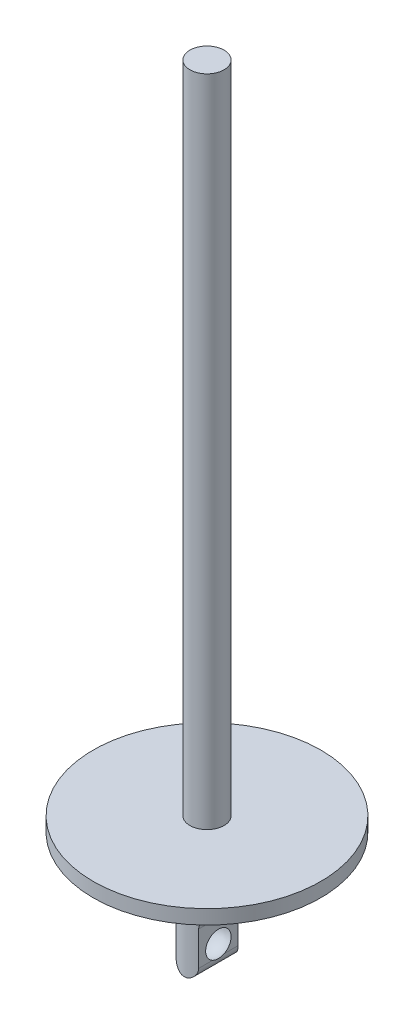
from build123d import *

# Parameters (mm, degrees)
SCHIZZO1_R                   = 8
ESTRUSIONE_ESTRUSIONE1_DEPTH = 40
SCHIZZO2_R                   = 40
ESTRUSIONE_ESTRUSIONE2_DEPTH = 5
SCHIZZO3_R                   = 6
ESTRUSIONE_ESTRUSIONE3_DEPTH = 230
SCHIZZO4_W                   = 4
SCHIZZO4_H                   = 20
TAGLIO_ESTRUSIONE1_DEPTH     = 281.757902827
RACCORDO1_R                  = 4


with BuildPart() as part:
    # Schizzo1 → Estrusione-Estrusione1 (new body)
    with BuildSketch(Plane(origin=(0, 0, 0), x_dir=(1, 0, 0), z_dir=(0, 1, 0))):
        with Locations(Location((0, 0, 0), (0, 0, 270))):
            Circle(SCHIZZO1_R)
    extrude(amount=ESTRUSIONE_ESTRUSIONE1_DEPTH)

    # Schizzo2 → Estrusione-Estrusione2 (add)
    with BuildSketch(Plane(origin=(0, 40, 0), x_dir=(1, 0, 0), z_dir=(0, 1, 0))):
        with Locations(Location((0, 0, 0), (0, 0, 270))):
            Circle(SCHIZZO2_R)
    extrude(amount=ESTRUSIONE_ESTRUSIONE2_DEPTH)

    # Schizzo3 → Estrusione-Estrusione3 (add)
    with BuildSketch(Plane(origin=(0, 45, 0), x_dir=(1, 0, 0), z_dir=(0, 1, 0))):
        with Locations(Location((0, 0, 0), (0, 0, 270))):
            Circle(SCHIZZO3_R)
    extrude(amount=ESTRUSIONE_ESTRUSIONE3_DEPTH)

    # Schizzo4 → Taglio-Estrusione1 (cut, symmetric)
    with BuildSketch(Plane.XY):
        with Locations((6, 10)):
            Rectangle(SCHIZZO4_W, SCHIZZO4_H)
    taglio_estrusione1 = extrude(amount=TAGLIO_ESTRUSIONE1_DEPTH, both=True, mode=Mode.SUBTRACT)

    # Specchia1: Taglio-Estrusione1 across plane
    add(taglio_estrusione1.mirror(Plane(origin=(0, 0, 0), x_dir=(0, 0, 1), z_dir=(1, 0, 0))), mode=Mode.SUBTRACT)


with BuildPart() as body_2:
    # Schizzo5 → Rivoluzione1 (revolve)
    with BuildSketch(Plane(origin=(0, 0, 0), x_dir=(0, 0, -1), z_dir=(1, 0, 0))):
        with BuildLine():
            Line((-6, 8), (6, 8))
            ThreePointArc((6, 8), (0, 14), (-6, 8))
        make_face()
    revolve(axis=Axis((0, 8, 6), (0, 0, -1)))


with BuildPart() as part_1:
    add(part.part)

    # Abbina1: cut body 2
    add(body_2.part, mode=Mode.SUBTRACT)

    # Raccordo1
    # the kernel refuses this fillet: 4 mm, written as the material it adds along each edge
    with BuildSketch(Plane(origin=(4, 20, 16.92820323), x_dir=(0, -1, 0), z_dir=(0, 0, -1))) as raccordo1_piece_1_section:
        with BuildLine():
            CenterArc((RACCORDO1_R, -RACCORDO1_R), RACCORDO1_R, 90, 90)
            Line((0, -RACCORDO1_R), (0, 0))
            Line((0, 0), (RACCORDO1_R, 0))
        make_face()
    raccordo1_piece_1 = extrude(amount=33.856406461, mode=Mode.PRIVATE)
    raccordo1_piece_1 = raccordo1_piece_1 & Plane(origin=(0, 19.029808041, 0), x_dir=(0, 0, 1), z_dir=(0, -1, 0)) * Cylinder(8, 84, mode=Mode.PRIVATE)
    add(raccordo1_piece_1)
    with BuildSketch(Plane(origin=(-4, 20, 16.92820323), x_dir=(0, -1, 0), z_dir=(0, 0, -1))) as raccordo1_piece_2_section:
        with BuildLine():
            CenterArc((RACCORDO1_R, RACCORDO1_R), RACCORDO1_R, 180, 90)
            Line((0, RACCORDO1_R), (0, 0))
            Line((0, 0), (RACCORDO1_R, 0))
        make_face()
    raccordo1_piece_2 = extrude(amount=33.856406461, mode=Mode.PRIVATE)
    raccordo1_piece_2 = raccordo1_piece_2 & Plane(origin=(0, 19.029808041, 0), x_dir=(0, 0, 1), z_dir=(0, -1, 0)) * Cylinder(8, 84, mode=Mode.PRIVATE)
    add(raccordo1_piece_2)
    # the kernel refuses this fillet: 4 mm, written as the material it takes off along each edge
    with BuildSketch(Plane(origin=(-4, 0, 16.92820323), x_dir=(1, 0, 0), z_dir=(0, 0, -1))) as raccordo1_2_piece_1:
        with BuildLine():
            CenterArc((RACCORDO1_R, -RACCORDO1_R), RACCORDO1_R, 90, 90)
            Line((0, -RACCORDO1_R), (0, 0))
            Line((0, 0), (RACCORDO1_R, 0))
        make_face()
    extrude(amount=33.856406461, mode=Mode.SUBTRACT)
    with BuildSketch(Plane(origin=(4, 0, 16.92820323), x_dir=(-1, 0, 0), z_dir=(0, 0, -1))) as raccordo1_2_piece_2:
        with BuildLine():
            CenterArc((RACCORDO1_R, RACCORDO1_R), RACCORDO1_R, 180, 90)
            Line((0, RACCORDO1_R), (0, 0))
            Line((0, 0), (RACCORDO1_R, 0))
        make_face()
    extrude(amount=33.856406461, mode=Mode.SUBTRACT)


solid = part_1.part
